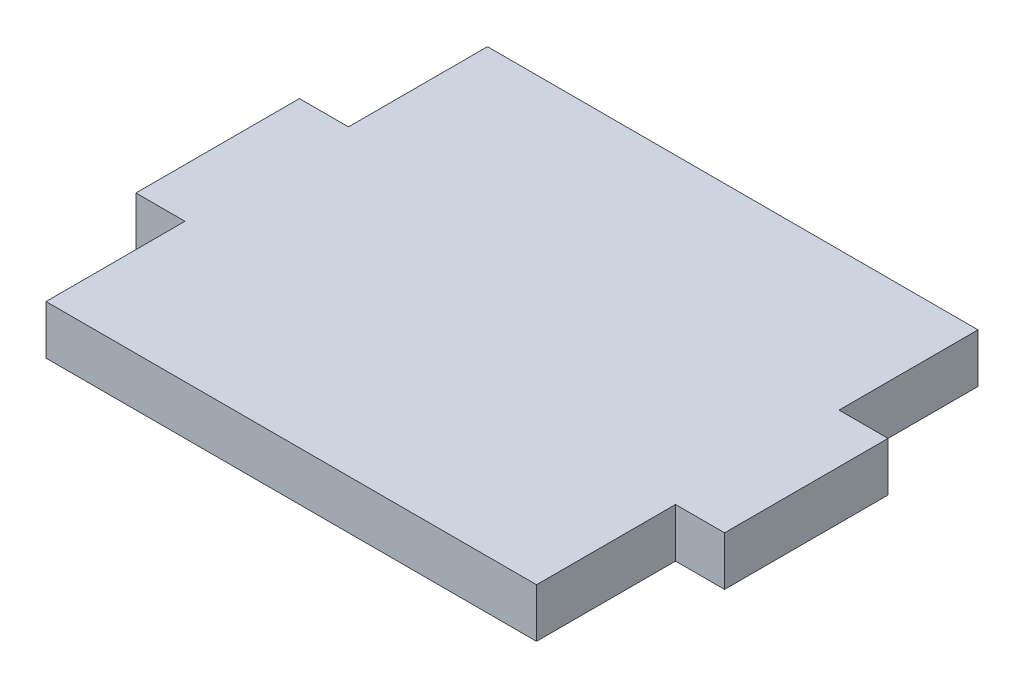
from build123d import *

# Parameters (mm, degrees)
SALIENTE_EXTRUIR1_DEPTH = 3


with BuildPart() as part:
    # Croquis1 → Saliente-Extruir1 (new body)
    with BuildSketch(Plane(origin=(0, 0, 0), x_dir=(1, 0, 0), z_dir=(0, 1, 0))):
        Polygon((0, 0), (30, 0), (30, 8.5), (33, 8.5), (33, 13.5), (33, 18.5), (30, 18.5), (30, 27), (0, 27), (0, 18.5), (-3, 18.5), (-3, 13.5), (-3, 8.5), (0, 8.5), align=None)
    extrude(amount=SALIENTE_EXTRUIR1_DEPTH)


solid = part.part
